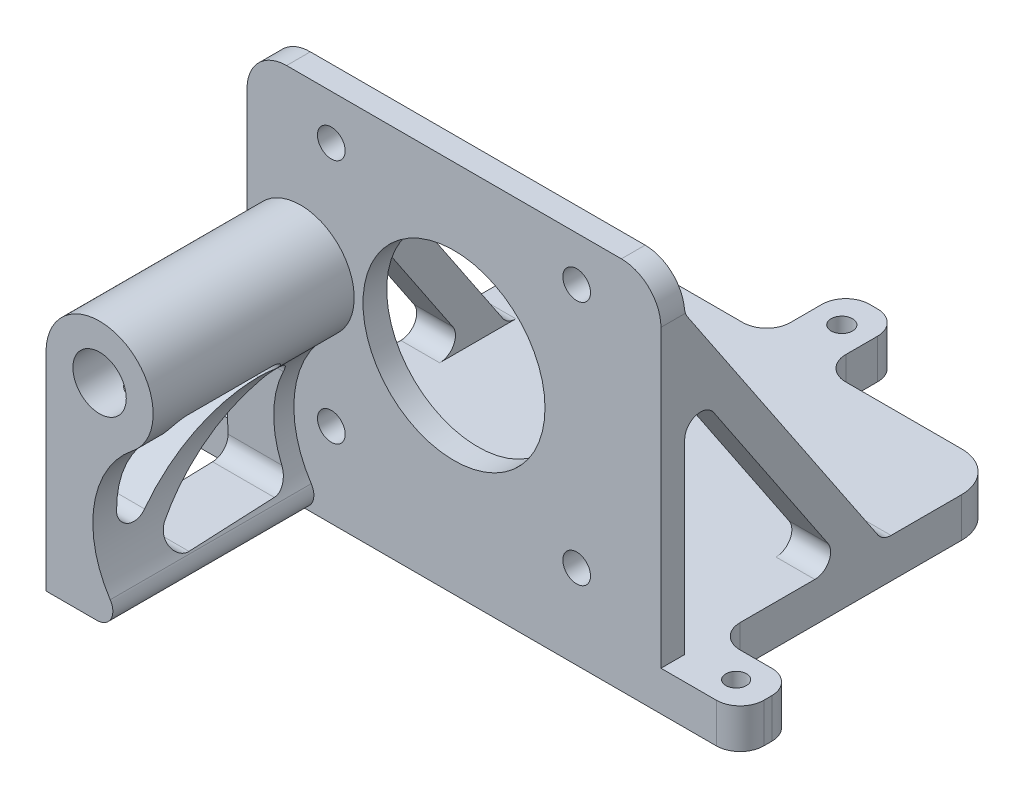
from build123d import *
from build123d.topology import SkipClean

# Parameters (mm, degrees)
SKETCH1_W           = 52.3
SKETCH1_H           = 52.3
SKETCH1_R           = 11.5
SKETCH1_R_2         = 1.75
BOSS_EXTRUDE1_DEPTH = 3
SKETCH2_W           = 52.3
SKETCH2_H           = 5
BOSS_EXTRUDE2_DEPTH = 40
SKETCH3_W           = 3
SKETCH3_H           = 5
CUT_EXTRUDE1_DEPTH  = 71.845695
BOSS_EXTRUDE3_DEPTH = 4.9
FILLET1_R           = 5
FILLET2_R           = 2
SKETCH5_W           = 10
SKETCH5_H           = 7
SKETCH5_R           = 1.3
BOSS_EXTRUDE4_DEPTH = 5
SKETCH6_W           = 7
SKETCH6_H           = 10
SKETCH6_R           = 1.35
BOSS_EXTRUDE5_DEPTH = 5
FILLET3_R           = 3
FILLET4_R           = 3
SKETCH7_R           = 3.3734375
BOSS_EXTRUDE6_DEPTH = 25.4
FILLET5_R           = 2
CUT_EXTRUDE2_DEPTH  = 85.05422357
FILLET6_START       = -26.15
FILLET6_DEPTH       = 7.129662431
FILLET6_START_2     = -20.042964894
FILLET6_2_DEPTH     = 4.85752147
FILLET6_START_3     = -16.0065624
FILLET6_3_DEPTH     = 2.695573852
FILLET6_4_DEPTH     = 1.974476163
FILLET6_5_DEPTH     = 1.685079156
FILLET6_START_4     = 2.9999999
FILLET6_6_DEPTH     = 22.4000001
FILLET6_START_5     = 5.780256625
FILLET6_7_DEPTH     = 0.960746932


with BuildPart() as part:
    # Sketch1 → Boss-Extrude1 (new body)
    with BuildSketch(Plane.XY):
        Rectangle(SKETCH1_W, SKETCH1_H)
        Circle(SKETCH1_R, mode=Mode.SUBTRACT)
        with Locations((-15.5, 15.5)):
            Circle(SKETCH1_R_2, mode=Mode.SUBTRACT)
        with Locations((15.5, 15.5)):
            Circle(SKETCH1_R_2, mode=Mode.SUBTRACT)
        with Locations((-15.5, -15.5)):
            Circle(SKETCH1_R_2, mode=Mode.SUBTRACT)
        with Locations((15.5, -15.5)):
            Circle(SKETCH1_R_2, mode=Mode.SUBTRACT)
    extrude(amount=BOSS_EXTRUDE1_DEPTH)

    # Sketch2 → Boss-Extrude2 (add)
    with BuildSketch(Plane(origin=(0, 0, 0), x_dir=(-1, 0, 0), z_dir=(0, 0, -1))):
        with Locations((0, -23.65)):
            Rectangle(SKETCH2_W, SKETCH2_H)
    extrude(amount=BOSS_EXTRUDE2_DEPTH)

    # Sketch3 → Cut-Extrude1 (cut, through all)
    with BuildSketch(Plane(origin=(26.15, 0, 0), x_dir=(0, 0, -1), z_dir=(1, 0, 0))):
        with Locations((-1.5, 23.65)):
            Rectangle(SKETCH3_W, SKETCH3_H)
    extrude(amount=-CUT_EXTRUDE1_DEPTH, mode=Mode.SUBTRACT)

    # Sketch4 → Boss-Extrude3 (add)
    with BuildSketch(Plane(origin=(26.15, 0, 0), x_dir=(0, 0, -1), z_dir=(1, 0, 0))):
        Polygon((0, 16.15), (25, -21.15), (20.184652233, -21.15), (0, 8.965501131), align=None)
    boss_extrude3 = extrude(amount=-BOSS_EXTRUDE3_DEPTH)

    # Mirror1: Boss-Extrude3 across plane
    add(boss_extrude3.mirror(Plane(origin=(0, 0, 0), x_dir=(0, 0, 1), z_dir=(1, 0, 0))))

    # Fillet1
    fillet1_edges = [part.edges().sort_by_distance(p)[0] for p in [
        (-26.15, -23.65, -40),
        (26.15, -23.65, -40),
        (-26.15, 21.15, 1.5),
        (26.15, 21.15, 1.5),
    ]]
    fillet(fillet1_edges, radius=FILLET1_R)

    # Fillet2
    fillet2_edges = [part.edges().sort_by_distance(p)[0] for p in [
        (23.7, 8.965501131, 0),
        (23.7, 16.15, 0),
        (23.7, -21.15, -25),
        (23.7, -21.15, -20.184652233),
        (-23.7, 16.15, 0),
        (-23.7, 8.965501131, 0),
        (-23.7, -21.15, -20.184652233),
        (-23.7, -21.15, -25),
    ]]
    fillet(fillet2_edges, radius=FILLET2_R)

    # Sketch5 → Boss-Extrude4 (add)
    with BuildSketch(Plane(origin=(0, -26.15, 0), x_dir=(1, 0, 0), z_dir=(0, 1, 0))):
        with Locations((-31.15, 0.5)):
            Rectangle(SKETCH5_W, SKETCH5_H)
        with Locations((-32.15, 0.5)):
            Circle(SKETCH5_R, mode=Mode.SUBTRACT)
    boss_extrude4 = extrude(amount=BOSS_EXTRUDE4_DEPTH)

    # Mirror2: Boss-Extrude4 across plane
    add(boss_extrude4.mirror(Plane(origin=(0, 0, 0), x_dir=(0, 0, 1), z_dir=(1, 0, 0))))

    # Sketch6 → Boss-Extrude5 (add)
    with BuildSketch(Plane.XZ.offset(26.15)):
        with Locations((0, -45)):
            Rectangle(SKETCH6_W, SKETCH6_H)
        with Locations(Location((0, -46, 0), (0, 0, 270))):
            Circle(SKETCH6_R, mode=Mode.SUBTRACT)
    extrude(amount=-BOSS_EXTRUDE5_DEPTH)

    # Fillet3
    fillet3_edges = [part.edges().sort_by_distance(p)[0] for p in [
        (-26.15, -23.65, -4),
        (-36.15, -23.65, -4),
        (-36.15, -23.65, 3),
        (36.15, -23.65, -4),
        (36.15, -23.65, 3),
        (26.15, -23.65, -4),
    ]]
    fillet(fillet3_edges, radius=FILLET3_R)

    # Fillet4
    fillet4_edges = [part.edges().sort_by_distance(p)[0] for p in [
        (3.5, -23.65, -50),
        (3.5, -23.65, -40),
        (-3.5, -23.65, -40),
        (-3.5, -23.65, -50),
    ]]
    fillet(fillet4_edges, radius=FILLET4_R)

    # Sketch7 → Boss-Extrude6 (add)
    with BuildSketch(Plane.XY.offset(3)):
        with BuildLine():
            Line((-26.15, 0), (-26.15, -26.15))
            Line((-26.15, -26.15), (-15.185443524, -26.15))
            ThreePointArc((-15.185443524, -26.15), (-20.234553545, -15.731999999), (-15.185443524, -5.313999997))
            ThreePointArc((-15.185443524, -5.313999997), (-16.427394993, 6.092210081), (-26.15, 0))
        make_face()
        with Locations((-19.38, 0)):
            Circle(SKETCH7_R, mode=Mode.SUBTRACT)
    extrude(amount=BOSS_EXTRUDE6_DEPTH)

    # Fillet5
    fillet5_edges = [part.edges().sort_by_distance(p)[0] for p in [
        (-15.185443524, -26.15, 15.7),
    ]]
    fillet(fillet5_edges, radius=FILLET5_R)

    # Sketch8 → Cut-Extrude2 (cut, through all)
    with BuildSketch(Plane.ZY.offset(26.15)):
        Polygon((8.005079096, -3), (25.4, -3), (25.4, -20.908550458), align=None)
        Polygon((5.347073795, -22.477794478), (23.248044349, -22.998786539), (5.853123446, -5.090236082), align=None)
    extrude(amount=-CUT_EXTRUDE2_DEPTH, mode=Mode.SUBTRACT)

    # Fillet6: read off the stored shape, not the designer's step
    # Fillet6 outline → Fillet6 (add)
    with BuildSketch(Plane.YZ.offset(FILLET6_START)):
        with BuildLine():
            ThreePointArc((-3, 12.735879268), (-4.221212944, 10.893736299), (-6.393490721, 11.301242168))
            Line((-6.393490721, 11.301242168), (-3, 8.005079096))
            Line((-3, 8.005079096), (-3, 12.735879268))
        make_face()
        with BuildLine():
            Line((-20.908550458, 25.4), (-17.372496907, 21.965362899))
            ThreePointArc((-17.372496907, 21.965362899), (-17.832283581, 24.151906177), (-15.979006186, 25.4))
            Line((-15.979006186, 25.4), (-20.908550458, 25.4))
        make_face()
        with BuildLine():
            ThreePointArc((-5, 25.4), (-3.585786438, 24.814213562), (-3, 23.4))
            Line((-3, 23.4), (-3, 25.4))
            Line((-3, 25.4), (-5, 25.4))
        make_face()
        with BuildLine():
            ThreePointArc((-22.855377198, 18.320586538), (-21.661726823, 20.209388823), (-19.462732989, 19.813407249))
            Line((-19.462732989, 19.813407249), (-22.998786539, 23.248044349))
            Line((-22.998786539, 23.248044349), (-22.855377198, 18.320586538))
        make_face()
        with BuildLine():
            Line((-5.090236082, 5.853123446), (-8.483726803, 9.149286517))
            ThreePointArc((-8.483726803, 9.149286517), (-8.013197931, 6.989783251), (-9.819033913, 5.715495928))
            Line((-9.819033913, 5.715495928), (-5.090236082, 5.853123446))
        make_face()
        with BuildLine():
            ThreePointArc((-20.47864099, 5.405257406), (-21.909297563, 5.94965388), (-22.535978089, 7.346227283))
            Line((-22.535978089, 7.346227283), (-22.477794478, 5.347073795))
            Line((-22.477794478, 5.347073795), (-20.47864099, 5.405257406))
        make_face()
    extrude(amount=FILLET6_DEPTH)

    # Fillet6 2 outline → Fillet6 2 (add)
    with BuildSketch(Plane.YZ.offset(FILLET6_START_2)):
        with BuildLine():
            ThreePointArc((-3, 12.735879268), (-4.221212944, 10.893736299), (-6.393490721, 11.301242168))
            Line((-6.393490721, 11.301242168), (-3, 8.005079096))
            Line((-3, 8.005079096), (-3, 12.735879268))
        make_face()
        with BuildLine():
            ThreePointArc((-5, 25.4), (-3.585786438, 24.814213562), (-3, 23.4))
            Line((-3, 23.4), (-3, 25.4))
            Line((-3, 25.4), (-5, 25.4))
        make_face()
        with BuildLine():
            Line((-5.090236082, 5.853123446), (-8.483726803, 9.149286517))
            ThreePointArc((-8.483726803, 9.149286517), (-8.013197931, 6.989783251), (-9.819033913, 5.715495928))
            Line((-9.819033913, 5.715495928), (-5.090236082, 5.853123446))
        make_face()
    extrude(amount=FILLET6_2_DEPTH)

    # Fillet6 3 outline → Fillet6 3 (add)
    with BuildSketch(Plane.YZ.offset(FILLET6_START_3)):
        with BuildLine():
            ThreePointArc((-3, 12.735879268), (-4.221212944, 10.893736299), (-6.393490721, 11.301242168))
            Line((-6.393490721, 11.301242168), (-3, 8.005079096))
            Line((-3, 8.005079096), (-3, 12.735879268))
        make_face()
        with BuildLine():
            ThreePointArc((-5, 25.4), (-3.585786438, 24.814213562), (-3, 23.4))
            Line((-3, 23.4), (-3, 25.4))
            Line((-3, 25.4), (-5, 25.4))
        make_face()
    extrude(amount=FILLET6_3_DEPTH)

    # Fillet6 4 outline → Fillet6 4 (add)
    with BuildSketch(Plane.YZ.offset(FILLET6_START_2)):
        with BuildLine():
            ThreePointArc((-22.855377198, 18.320586538), (-21.661726823, 20.209388823), (-19.462732989, 19.813407249))
            Line((-19.462732989, 19.813407249), (-22.998786539, 23.248044349))
            Line((-22.998786539, 23.248044349), (-22.855377198, 18.320586538))
        make_face()
    extrude(amount=FILLET6_4_DEPTH)

    # Fillet6 5 outline → Fillet6 5 (add)
    with BuildSketch(Plane.YZ.offset(FILLET6_START_2)):
        with BuildLine():
            ThreePointArc((-20.47864099, 5.405257406), (-21.909297563, 5.94965388), (-22.535978089, 7.346227283))
            Line((-22.535978089, 7.346227283), (-22.477794478, 5.347073795))
            Line((-22.477794478, 5.347073795), (-20.47864099, 5.405257406))
        make_face()
    extrude(amount=FILLET6_5_DEPTH)

    # Fillet6 6 outline → Fillet6 6 (cut)
    with SkipClean():  # the faces are left unmerged after this step: merging them gives an invalid solid
        with BuildSketch(Plane.XY.offset(FILLET6_START_4)):
            with BuildLine():
                Line((-18.03638138, -23.047623669), (-17.407246032, -24))
                Line((-17.407246032, -24), (-13.310988548, -24))
                Line((-13.310988548, -24), (-13.310988548, -3))
                ThreePointArc((-13.310988548, -3), (-14.11940539, -4.261343022), (-15.185443524, -5.313999997))
                ThreePointArc((-15.185443524, -5.313999997), (-20.066293198, -13.625309136), (-18.03638138, -23.047623669))
            make_face()
            with BuildLine():
                Line((-17.837249026, -3), (-20.922750974, -3))
                ThreePointArc((-20.922750974, -3), (-19.38, -3.3734375), (-17.837249026, -3))
            make_face()
        extrude(amount=FILLET6_6_DEPTH, mode=Mode.SUBTRACT)

    # Fillet6 7 outline → Fillet6 7 (add)
    with BuildSketch(Plane.XY.offset(FILLET6_START_5)):
        with BuildLine():
            Line((-15.185443424, -1), (-15.185443524, -5.313999997))
            ThreePointArc((-15.185443524, -5.313999997), (-13.523185641, -3.395677481), (-12.68426255, -1))
            Line((-12.68426255, -1), (-15.185443424, -1))
        make_face()
    extrude(amount=FILLET6_7_DEPTH)


solid = part.part
